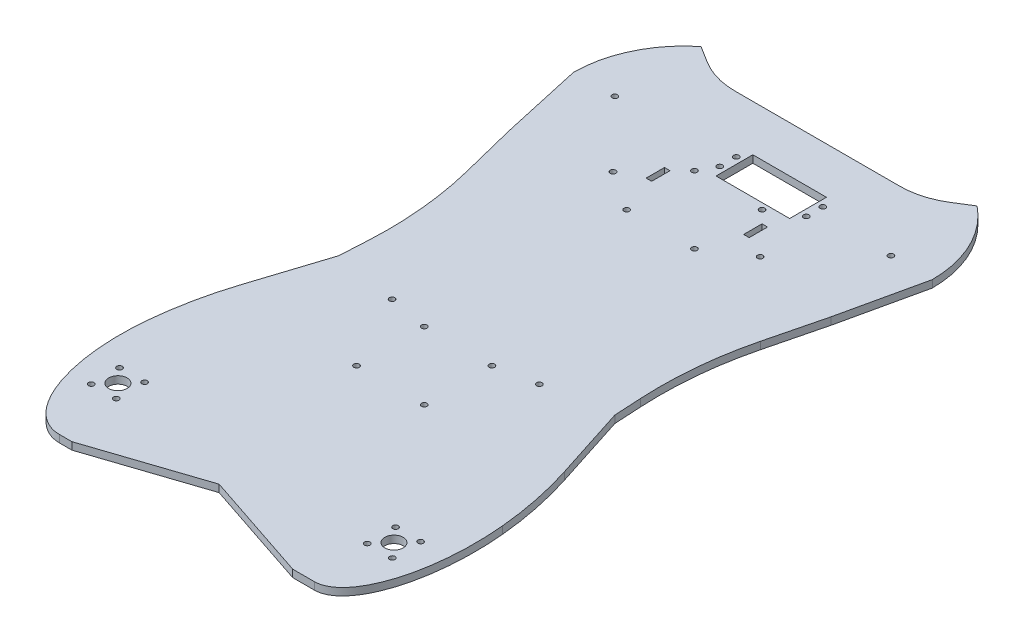
from build123d import *

# Parameters (mm, degrees)
SKETCH_3_R      = 1.5
SKETCH_3_R_2    = 5
SKETCH_3_W      = 3
SKETCH_3_H      = 10
EXTRUDE_1_DEPTH = 4
FILLET_2_R      = 5
FILLET_4_R      = 200
FILLET_5_R      = 200
FILLET_8_R      = 200
FILLET_9_R      = 200
FILLET_START    = -1
FILLET_10_DEPTH = 6
FILLET_11_DEPTH = 6
FILLET_13_R     = 200
FILLET_1_R      = 40


with BuildPart() as part:
    # Эскиз3 → Бобышка-Вытянуть1 (new body)
    with BuildSketch(Plane(origin=(0, 0, 0), x_dir=(1, 0, 0), z_dir=(0, 1, 0))):
        with BuildLine():
            Line((18.75, 35.128113741), (131.25, 35.128113741))
            Line((131.25, 35.128113741), (150, 46.837484988))
            ThreePointArc((150, 46.837484988), (166.583269132, 25.980762114), (172.5, 0))
            Line((172.5, 0), (162.5, -45))
            Line((162.5, -45), (147.5, -105))
            Line((147.5, -105), (150, -150))
            Line((150, -150), (172.5, -220))
            Line((172.5, -220), (172.5, -310))
            Line((172.5, -310), (135, -310))
            Line((135, -310), (75, -290))
            Line((75, -290), (15, -310))
            Line((15, -310), (-22.5, -310))
            Line((-22.5, -310), (-22.5, -220))
            Line((-22.5, -220), (0, -150))
            Line((0, -150), (2.5, -105))
            Line((2.5, -105), (-12.5, -45))
            Line((-12.5, -45), (-22.5, 0))
            ThreePointArc((-22.5, 0), (-16.583269132, 25.980762114), (0, 46.837484988))
            Line((0, 46.837484988), (18.75, 35.128113741))
        make_face()
        with Locations(Location((150, 0, 0), (0, 0, 270))):
            Circle(SKETCH_3_R, mode=Mode.SUBTRACT)
        with Locations(Location((0, 0, 0), (0, 0, 270))):
            Circle(SKETCH_3_R, mode=Mode.SUBTRACT)
        with Locations(Location((150, -270, 0), (0, 0, 270))):
            Circle(SKETCH_3_R_2, mode=Mode.SUBTRACT)
        with Locations(Location((0, -270, 0), (0, 0, 270))):
            Circle(SKETCH_3_R_2, mode=Mode.SUBTRACT)
        with Locations(Location((-6.8, -262.3, 0), (0, 0, 270))):
            Circle(SKETCH_3_R, mode=Mode.SUBTRACT)
        with Locations(Location((6.8, -262.3, 0), (0, 0, 270))):
            Circle(SKETCH_3_R, mode=Mode.SUBTRACT)
        with Locations(Location((-6.8, -277.7, 0), (0, 0, 270))):
            Circle(SKETCH_3_R, mode=Mode.SUBTRACT)
        with Locations(Location((6.8, -277.7, 0), (0, 0, 270))):
            Circle(SKETCH_3_R, mode=Mode.SUBTRACT)
        with Locations(Location((143.2, -262.3, 0), (0, 0, 270))):
            Circle(SKETCH_3_R, mode=Mode.SUBTRACT)
        with Locations(Location((156.8, -262.3, 0), (0, 0, 270))):
            Circle(SKETCH_3_R, mode=Mode.SUBTRACT)
        with Locations(Location((143.2, -277.7, 0), (0, 0, 270))):
            Circle(SKETCH_3_R, mode=Mode.SUBTRACT)
        with Locations(Location((156.8, -277.7, 0), (0, 0, 270))):
            Circle(SKETCH_3_R, mode=Mode.SUBTRACT)
        with Locations(Location((61.5, 4.5, 0), (0, 0, 270))):
            Circle(SKETCH_3_R, mode=Mode.SUBTRACT)
        with Locations(Location((61.5, -4.5, 0), (0, 0, 270))):
            Circle(SKETCH_3_R, mode=Mode.SUBTRACT)
        with Locations(Location((108.5, -4.5, 0), (0, 0, 90))):
            Circle(SKETCH_3_R, mode=Mode.SUBTRACT)
        with Locations(Location((108.5, 4.5, 0), (0, 0, 90))):
            Circle(SKETCH_3_R, mode=Mode.SUBTRACT)
        with Locations(Location((35, -36, 0), (0, 0, 270))):
            Circle(SKETCH_3_R, mode=Mode.SUBTRACT)
        with Locations(Location((115, -36, 0), (0, 0, 270))):
            Circle(SKETCH_3_R, mode=Mode.SUBTRACT)
        with Locations(Location((115, -156, 0), (0, 0, 270))):
            Circle(SKETCH_3_R, mode=Mode.SUBTRACT)
        with Locations(Location((35, -156, 0), (0, 0, 270))):
            Circle(SKETCH_3_R, mode=Mode.SUBTRACT)
        with Locations(Location((56.615223689, -196.934776311, 0), (0, 0, 270))):
            Circle(SKETCH_3_R, mode=Mode.SUBTRACT)
        with Locations(Location((93.384776311, -196.934776311, 0), (0, 0, 270))):
            Circle(SKETCH_3_R, mode=Mode.SUBTRACT)
        with Locations(Location((93.384776311, -160.165223689, 0), (0, 0, 270))):
            Circle(SKETCH_3_R, mode=Mode.SUBTRACT)
        with Locations(Location((56.615223689, -160.165223689, 0), (0, 0, 270))):
            Circle(SKETCH_3_R, mode=Mode.SUBTRACT)
        with Locations(Location((56.615223689, -50.134776311, 0), (0, 0, 270))):
            Circle(SKETCH_3_R, mode=Mode.SUBTRACT)
        with Locations(Location((93.384776311, -50.134776311, 0), (0, 0, 270))):
            Circle(SKETCH_3_R, mode=Mode.SUBTRACT)
        with Locations(Location((93.384776311, -13.365223689, 0), (0, 0, 270))):
            Circle(SKETCH_3_R, mode=Mode.SUBTRACT)
        with Locations(Location((56.615223689, -13.365223689, 0), (0, 0, 270))):
            Circle(SKETCH_3_R, mode=Mode.SUBTRACT)
        Polygon((65, 10), (65, 0), (65, -10), (75, -10), (105, -10), (105, 10), (85, 10), align=None, mode=Mode.SUBTRACT)
        with Locations((48.5, -25)):
            Rectangle(SKETCH_3_W, SKETCH_3_H, mode=Mode.SUBTRACT)
        with Locations((101.5, -25)):
            Rectangle(SKETCH_3_W, SKETCH_3_H, mode=Mode.SUBTRACT)
    extrude(amount=EXTRUDE_1_DEPTH)

    # Скругление2
    fillet_2_edges = [part.edges().sort_by_distance(p)[0] for p in [
        (-22.5, 2, 0),
    ]]
    fillet(fillet_2_edges, radius=FILLET_2_R)

    # Скругление4
    # the kernel refuses this fillet: 200 mm, written as the material it takes off along each edge
    with BuildSketch(Plane(origin=(-12.5, -6.577808748, 45), x_dir=(-0.21693045781865417, 0, -0.9761870601839532), z_dir=(0, 1, 0))) as fillet_4_piece_1:
        with BuildLine():
            CenterArc((FILLET_4_R * 0.0131556174964, -FILLET_4_R), FILLET_4_R, 90, 1.507435759)
            Line((-FILLET_4_R * 0.0131510645918, -FILLET_4_R * 0.000346080647153), (0, 0))
            Line((0, 0), (FILLET_4_R * 0.0131556174964, 0))
        make_face()
    extrude(amount=17.155617496, mode=Mode.SUBTRACT)

    # Скругление5
    fillet_5_edges = [part.edges().sort_by_distance(p)[0] for p in [
        (2.5, 2, 105),
    ]]
    fillet(fillet_5_edges, radius=FILLET_5_R)

    # Скругление8
    fillet_8_edges = [part.edges().sort_by_distance(p)[0] for p in [
        (-22.5, 2, 220),
    ]]
    fillet(fillet_8_edges, radius=FILLET_8_R)

    # Скругление9
    fillet_9_edges = [part.edges().sort_by_distance(p)[0] for p in [
        (172.5, 2, 220),
    ]]
    fillet(fillet_9_edges, radius=FILLET_9_R)

    # Скругление10: read off the stored shape, not the designer's step
    # Скругление10 outline → Скругление10 (cut)
    with BuildSketch(Plane(origin=(0, 0, 0), x_dir=(1, 0, 0), z_dir=(0, 1, 0)).offset(FILLET_START)):
        with BuildLine():
            Line((-22.5, -310), (8.288353461, -310))
            add(Edge.make_bspline(
                [(8.288353461, -310), (-29.099560998, -310), (-21.57252534, -232.114186903)],
                knots=[0, 0, 0, 1, 1, 1], degree=2, weights=[1, 0.672237395, 1]))
            ThreePointArc((-21.57252534, -232.114186903), (-22.267996771, -241.722392301), (-22.5, -251.352940882))
            Line((-22.5, -251.352940882), (-22.5, -310))
        make_face()
    extrude(amount=FILLET_10_DEPTH, mode=Mode.SUBTRACT)

    # Скругление11: read off the stored shape, not the designer's step
    # Скругление11 outline → Скругление11 (cut)
    with BuildSketch(Plane(origin=(0, 0, 0), x_dir=(1, 0, 0), z_dir=(0, 1, 0)).offset(FILLET_START)):
        with BuildLine():
            ThreePointArc((172.5, -251.352940882), (172.281100603, -241.998164461), (171.624881581, -232.663865588))
            add(Edge.make_bspline(
                [(171.624881581, -232.663865588), (178.883345855, -310), (146.734271383, -310)],
                knots=[0, 0, 0, 1, 1, 1], degree=2, weights=[1, 0.673258726, 1]))
            Line((146.734271383, -310), (172.5, -310))
            Line((172.5, -310), (172.5, -251.352940882))
        make_face()
    extrude(amount=FILLET_11_DEPTH, mode=Mode.SUBTRACT)

    # Скругление13
    fillet_13_edges = [part.edges().sort_by_distance(p)[0] for p in [
        (147.5, 2, 105),
    ]]
    fillet(fillet_13_edges, radius=FILLET_13_R)

    # Скругление1
    fillet_1_edges = [part.edges().sort_by_distance(p)[0] for p in [
        (18.75, 2, -35.128113741),
        (131.25, 2, -35.128113741),
    ]]
    fillet(fillet_1_edges, radius=FILLET_1_R)


solid = part.part
